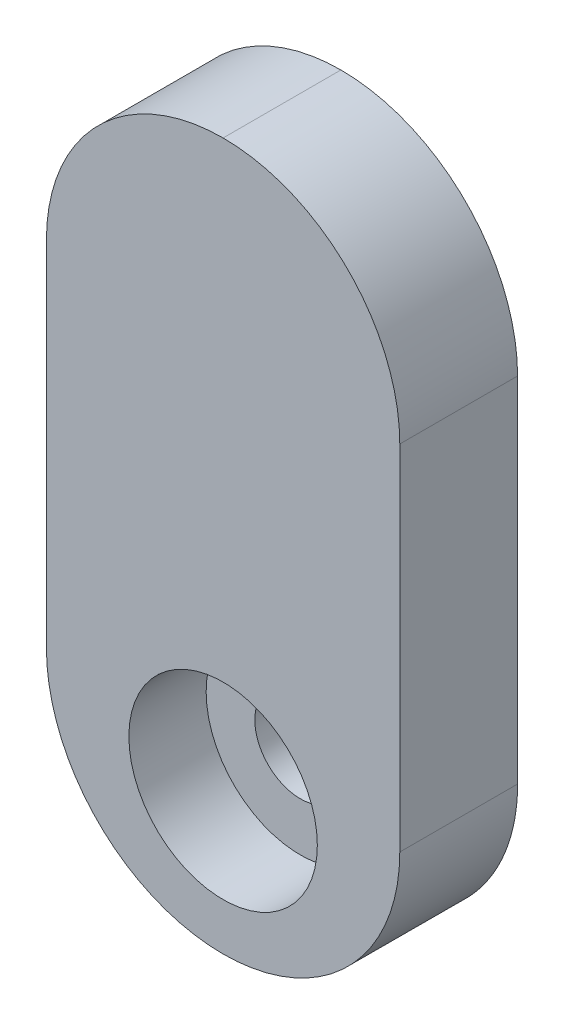
from build123d import *

# Parameters (mm, degrees)
SKETCH1_W                                      = 19.05
SKETCH1_H                                      = 38.1
BOSS_EXTRUDE1_DEPTH                            = 6.35
CBORE_FOR_8_SOCKET_HEAD_CAP_SCREW1_D           = 4.9149
CBORE_FOR_8_SOCKET_HEAD_CAP_SCREW1_CBORE_D     = 10.16
CBORE_FOR_8_SOCKET_HEAD_CAP_SCREW1_CBORE_DEPTH = 4.1656
BOSS_EXTRUDE2_START                            = 1.27
SKETCH4_R                                      = 7.62
SKETCH4_R_2                                    = 2.45745
BOSS_EXTRUDE2_DEPTH                            = 1.27
FILLET1_R                                      = 9.525


with BuildPart() as part:
    # Sketch1 → Boss-Extrude1 (new body)
    with BuildSketch(Plane.XY):
        with Locations((0, 19.05)):
            Rectangle(SKETCH1_W, SKETCH1_H)
    extrude(amount=BOSS_EXTRUDE1_DEPTH)

    # CBORE for #8 Socket Head Cap Screw1 (through all)
    with Locations(Plane.XY.offset(6.35)):
        with Locations((0, 7.62)):
            CounterBoreHole(CBORE_FOR_8_SOCKET_HEAD_CAP_SCREW1_D / 2, CBORE_FOR_8_SOCKET_HEAD_CAP_SCREW1_CBORE_D / 2, CBORE_FOR_8_SOCKET_HEAD_CAP_SCREW1_CBORE_DEPTH)

    # Sketch4 → Boss-Extrude2 (add)
    with BuildSketch(Plane(origin=(0, 0, 0), x_dir=(-1, 0, 0), z_dir=(0, 0, -1)).offset(BOSS_EXTRUDE2_START)):
        with Locations(Location((0, 7.62, 0), (0, 0, 270))):
            Circle(SKETCH4_R)
        with Locations(Location((0, 7.62, 0), (0, 0, 180))):
            Circle(SKETCH4_R_2, mode=Mode.SUBTRACT)
    extrude(amount=-BOSS_EXTRUDE2_DEPTH)

    # Fillet1
    fillet1_edges = [part.edges().sort_by_distance(p)[0] for p in [
        (9.525, 38.1, 3.175),
        (-9.525, 38.1, 3.175),
        (9.525, 0, 3.175),
        (-9.525, 0, 3.175),
    ]]
    fillet(fillet1_edges, radius=FILLET1_R - 0.0001)  # a hair under: the kernel refuses the full size


solid = part.part
